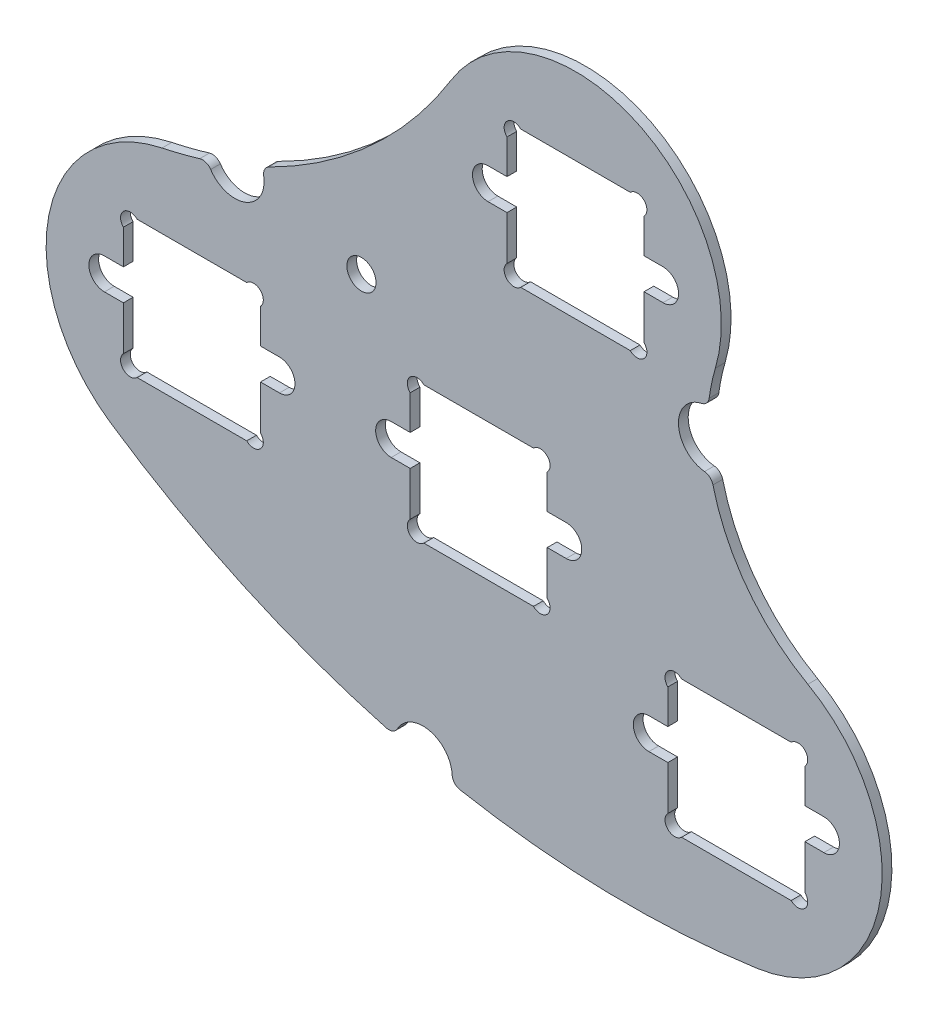
from build123d import *
from build123d.topology import SkipClean

# Parameters (mm, degrees)
BOSS_EXTRUDE1_DEPTH   = 1
SKETCH8_3_R           = 3
CUT_EXTRUDE1_DEPTH    = 182.285837692
SKETCH16_R            = 1.6
SKETCH16_W            = 18
SKETCH16_H            = 3.2
CUT_EXTRUDE2_DEPTH    = 182.285837692
CUT_EXTRUDE3_DEPTH    = 182.285837692
SKETCH9_W             = 14.1
SKETCH9_H             = 14.1
CUT_EXTRUDE4_DEPTH    = 182.285837692
F_3_0MM_DOWEL_HOLE1_D = 3
FILLET1_R             = 1


with BuildPart() as part:
    # Sketch8 → Boss-Extrude1 (new body)
    with BuildSketch(Plane.XY):
        with BuildLine():
            ThreePointArc((73.852303576, 63.794594289), (73.863549821, 63.839319131), (73.875482243, 63.883865813))
            ThreePointArc((73.875482243, 63.883865813), (76.767270103, 63.085390407), (79.729789892, 62.612657392))
            ThreePointArc((79.729789892, 62.612657392), (79.717062502, 62.538833177), (79.702495752, 62.465349771))
            ThreePointArc((79.702495752, 62.465349771), (95.373691885, 60.7573177), (111.111302129, 61.669121188))
            ThreePointArc((111.111302129, 61.669121188), (123.74416397, 73.75113123), (116.356165737, 89.593531525))
            ThreePointArc((116.356165737, 89.593531525), (107.510169126, 99.635128091), (106.844308874, 113.000828513))
            ThreePointArc((106.844308874, 113.000828513), (98.551785503, 130.943955248), (79.67265081, 125.087333856))
            ThreePointArc((79.67265081, 125.087333856), (66.957923375, 111.551078569), (49.923987164, 104.152462611))
            ThreePointArc((49.923987164, 104.152462611), (38.279791522, 92.371702096), (44.581782069, 77.053134095))
            ThreePointArc((44.581782069, 77.053134095), (58.651333394, 69.17496271), (73.852303576, 63.794594289))
        make_face()
        with BuildLine():
            ThreePointArc((56.72077423, 104.000844147), (56.721683918, 104.00117089), (56.7225936, 104.001497652))
            ThreePointArc((56.7225936, 104.001497652), (56.755397532, 103.992206145), (56.788325126, 103.983362865))
            ThreePointArc((56.788325126, 103.983362865), (56.754559843, 103.992142785), (56.72077423, 104.000844147))
        make_face(mode=Mode.SUBTRACT)
        with BuildLine():
            ThreePointArc((109.376341775, 92.015545509), (109.37615287, 92.017539878), (109.375963817, 92.019534234))
            ThreePointArc((109.375963817, 92.019534234), (109.377797318, 92.017499849), (109.379631064, 92.015465685))
            ThreePointArc((109.379631064, 92.015465685), (109.377986421, 92.015505684), (109.376341775, 92.015545509))
        make_face(mode=Mode.SUBTRACT)
        with BuildLine():
            ThreePointArc((103.532400156, 106.396636288), (103.543227812, 106.407709628), (103.554044399, 106.418793781))
            ThreePointArc((103.554044399, 106.418793781), (103.552293137, 106.396310438), (103.550744757, 106.373812212))
            ThreePointArc((103.550744757, 106.373812212), (103.541575551, 106.385226737), (103.532400156, 106.396636288))
        make_face(mode=Mode.SUBTRACT)
        with BuildLine():
            ThreePointArc((104.021801646, 107.681154775), (104.021865069, 107.684582448), (104.021929019, 107.688010111))
            ThreePointArc((104.021929019, 107.688010111), (104.063142491, 107.7381429), (104.104138674, 107.788453533))
            ThreePointArc((104.104138674, 107.788453533), (104.062244422, 107.735361058), (104.021801646, 107.681154775))
        make_face(mode=Mode.SUBTRACT)
    extrude(amount=BOSS_EXTRUDE1_DEPTH)

    # Sketch8<3> → Cut-Extrude1 (cut, through all)
    with SkipClean():  # the faces are left unmerged after this step: merging them gives an invalid solid
        with BuildSketch(Plane.XY):
            with Locations((106.04559389, 106.21341333)):
                Circle(SKETCH8_3_R)
            with Locations((76.767270103, 63.085390407)):
                Circle(SKETCH8_3_R)
            with Locations((57.420286528, 106.402169345)):
                Circle(SKETCH8_3_R)
        extrude(amount=CUT_EXTRUDE1_DEPTH, mode=Mode.SUBTRACT)

    # Sketch16 → Cut-Extrude2 (cut, through all)
    with SkipClean():  # the faces are left unmerged after this step: merging them gives an invalid solid
        with BuildSketch(Plane.XY):
            with Locations((43.996556322, 89.970524089)):
                Circle(SKETCH16_R)
            with Locations((61.996556322, 89.970524089)):
                Circle(SKETCH16_R)
            with Locations((73.496556322, 89.970524089)):
                Circle(SKETCH16_R)
            with Locations((91.496556322, 89.970524089)):
                Circle(SKETCH16_R)
            with Locations((100.001946024, 77.020067852)):
                Circle(SKETCH16_R)
            with Locations((118.001946024, 77.020067852)):
                Circle(SKETCH16_R)
            with Locations((83.45540719, 117.738694526)):
                Circle(SKETCH16_R)
            with Locations((101.45540719, 117.738694526)):
                Circle(SKETCH16_R)
            with Locations((52.996556322, 89.970524089)):
                Rectangle(SKETCH16_W, SKETCH16_H)
            with Locations((82.496556322, 89.970524089)):
                Rectangle(SKETCH16_W, SKETCH16_H)
            with Locations((109.001946024, 77.020067852)):
                Rectangle(SKETCH16_W, SKETCH16_H)
            with Locations((92.45540719, 117.738694526)):
                Rectangle(SKETCH16_W, SKETCH16_H)
        extrude(amount=CUT_EXTRUDE2_DEPTH, mode=Mode.SUBTRACT)

    # Sketch14 → Cut-Extrude3 (cut, through all)
    with SkipClean():  # the faces are left unmerged after this step: merging them gives an invalid solid
        with BuildSketch(Plane.XY):
            with BuildLine():
                Line((45.946556322, 95.106310527), (47.360769884, 96.520524089))
                ThreePointArc((47.360769884, 96.520524089), (45.946556322, 96.520524089), (45.946556322, 95.106310527))
            make_face()
            with BuildLine():
                Line((45.946556322, 83.834737652), (47.360769884, 82.420524089))
                ThreePointArc((47.360769884, 82.420524089), (45.946556322, 82.420524089), (45.946556322, 83.834737652))
            make_face()
            with BuildLine():
                Line((58.63234276, 82.420524089), (60.046556322, 83.834737652))
                ThreePointArc((60.046556322, 83.834737652), (60.046556322, 82.420524089), (58.63234276, 82.420524089))
            make_face()
            with BuildLine():
                Line((58.63234276, 96.520524089), (60.046556322, 95.106310527))
                ThreePointArc((60.046556322, 95.106310527), (60.046556322, 96.520524089), (58.63234276, 96.520524089))
            make_face()
            with BuildLine():
                Line((85.40540719, 111.602908088), (86.819620752, 110.188694526))
                ThreePointArc((86.819620752, 110.188694526), (85.40540719, 110.188694526), (85.40540719, 111.602908088))
            make_face()
            with BuildLine():
                Line((98.091193628, 110.188694526), (99.50540719, 111.602908088))
                ThreePointArc((99.50540719, 111.602908088), (99.50540719, 110.188694526), (98.091193628, 110.188694526))
            make_face()
            with BuildLine():
                Line((98.091193628, 124.288694526), (99.50540719, 122.874480963))
                ThreePointArc((99.50540719, 122.874480963), (99.50540719, 124.288694526), (98.091193628, 124.288694526))
            make_face()
            with BuildLine():
                Line((85.40540719, 122.874480963), (86.819620752, 124.288694526))
                ThreePointArc((86.819620752, 124.288694526), (85.40540719, 124.288694526), (85.40540719, 122.874480963))
            make_face()
            with BuildLine():
                Line((101.951946024, 82.155854289), (103.366159586, 83.570067852))
                ThreePointArc((103.366159586, 83.570067852), (101.951946024, 83.570067852), (101.951946024, 82.155854289))
            make_face()
            with BuildLine():
                Line((101.951946024, 70.884281414), (103.366159586, 69.470067852))
                ThreePointArc((103.366159586, 69.470067852), (101.951946024, 69.470067852), (101.951946024, 70.884281414))
            make_face()
            with BuildLine():
                Line((114.637732461, 69.470067852), (116.051946024, 70.884281414))
                ThreePointArc((116.051946024, 70.884281414), (116.051946024, 69.470067852), (114.637732461, 69.470067852))
            make_face()
            with BuildLine():
                Line((116.051946024, 82.155854289), (114.637732461, 83.570067852))
                ThreePointArc((114.637732461, 83.570067852), (116.051946024, 83.570067852), (116.051946024, 82.155854289))
            make_face()
            with BuildLine():
                Line((76.860769884, 96.520524089), (75.446556322, 95.106310527))
                ThreePointArc((75.446556322, 95.106310527), (75.446556322, 96.520524089), (76.860769884, 96.520524089))
            make_face()
            with BuildLine():
                Line((88.13234276, 96.520524089), (89.546556322, 95.106310527))
                ThreePointArc((89.546556322, 95.106310527), (89.546556322, 96.520524089), (88.13234276, 96.520524089))
            make_face()
            with BuildLine():
                Line((89.546556322, 83.834737652), (88.13234276, 82.420524089))
                ThreePointArc((88.13234276, 82.420524089), (89.546556322, 82.420524089), (89.546556322, 83.834737652))
            make_face()
            with BuildLine():
                Line((75.446556322, 83.834737652), (76.860769884, 82.420524089))
                ThreePointArc((76.860769884, 82.420524089), (75.446556322, 82.420524089), (75.446556322, 83.834737652))
            make_face()
        extrude(amount=CUT_EXTRUDE3_DEPTH, mode=Mode.SUBTRACT)

    # Sketch9 → Cut-Extrude4 (cut, through all)
    with SkipClean():  # the faces are left unmerged after this step: merging them gives an invalid solid
        with BuildSketch(Plane.XY):
            with Locations((52.996556322, 89.470524089)):
                Rectangle(SKETCH9_W, SKETCH9_H)
            with Locations((82.496556322, 89.470524089)):
                Rectangle(SKETCH9_W, SKETCH9_H)
            with Locations((109.001946024, 76.520067852)):
                Rectangle(SKETCH9_W, SKETCH9_H)
            with Locations((92.45540719, 117.238694526)):
                Rectangle(SKETCH9_W, SKETCH9_H)
        extrude(amount=CUT_EXTRUDE4_DEPTH, mode=Mode.SUBTRACT)

    # Ø3.0mm Dowel Hole1 (through all)
    with Locations(Plane.XY.offset(1)):
        with Locations((70.435309654, 103.157249982)):
            Hole(F_3_0MM_DOWEL_HOLE1_D / 2)

    # Fillet1
    fillet1_edges = [part.edges().sort_by_distance(p)[0] for p in [
        (79.702495752, 62.465349771, 0.5),
        (73.852303576, 63.794594289, 0.5),
        (106.42311517, 103.237261841, 0.5),
        (106.111211206, 109.212695638, 0.5),
        (54.596217873, 105.389926178, 0.5),
        (60.17229201, 107.596516793, 0.5),
    ]]
    fillet(fillet1_edges, radius=FILLET1_R)


solid = part.part
